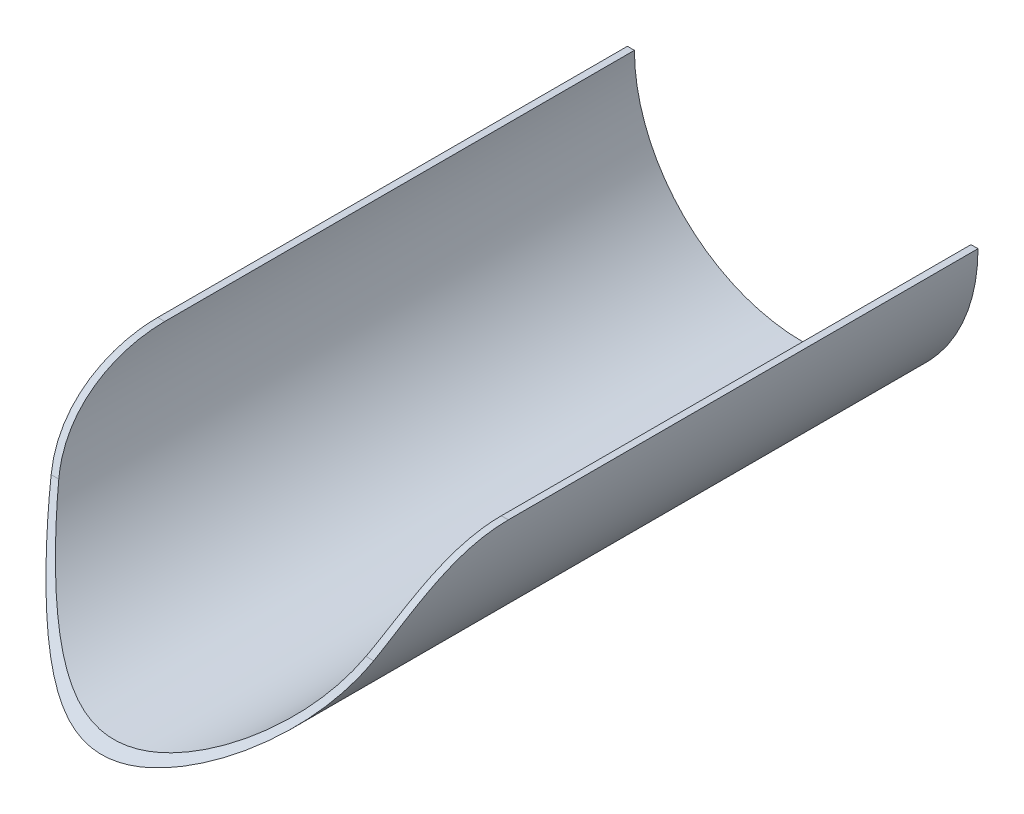
from build123d import *

# Parameters (mm, degrees)
EXTRUDE_THIN1_DEPTH     = 200
CUT_EXTRUDE1_DEPTH      = 213.132034356
CUT_EXTRUDE1_DEPTH_BACK = 213.132034356
FILLET1_R               = 40


with BuildPart() as part:
    # Sketch1 → Extrude-Thin1 (new body)
    with BuildSketch(Plane.XY):
        with BuildLine():
            ThreePointArc((-50, 0), (0, -50), (50, 0))
            Line((50, 0), (48, 0))
            ThreePointArc((48, 0), (0, -48), (-48, 0))
            Line((-48, 0), (-50, 0))
        make_face()
    extrude(amount=-EXTRUDE_THIN1_DEPTH)

    # Sketch2 → Cut-Extrude1 (cut, two sides: drawn at the far end of the back side and taken through both)
    with BuildSketch(Plane(origin=(0, 0, 0), x_dir=(0, 0, -1), z_dir=(1, 0, 0)).offset(-CUT_EXTRUDE1_DEPTH_BACK)):
        with BuildLine():
            Line((0, 0), (0, -50))
            ThreePointArc((0, -50), (25.082111762, -29.065689409), (40, 0))
            Line((40, 0), (0, 0))
        make_face()
    extrude(amount=CUT_EXTRUDE1_DEPTH + CUT_EXTRUDE1_DEPTH_BACK, mode=Mode.SUBTRACT)

    # Fillet1
    # the kernel refuses this fillet: 40 mm, written as the material it takes off along each edge
    with BuildSketch(Plane(origin=(115.07027284, 0, -40), x_dir=(0, 0, -1), z_dir=(-1, 0, 0)), Plane(origin=(17.07027284, 0, -40), x_dir=(0, 0, -1), z_dir=(-1, 0, 0))) as fillet1_piece_1:
        with BuildLine():
            CenterArc((26.028109136, 40), FILLET1_R, 210.63069692, 59.36930308)
            ThreePointArc((-8.390657995, 19.619900167), (-3.554396204, 10.084051777), (0, 0))
            Line((0, 0), (26.028109136, 0))
        make_face()
    extrude(amount=132.140545681, mode=Mode.SUBTRACT)


solid = part.part
